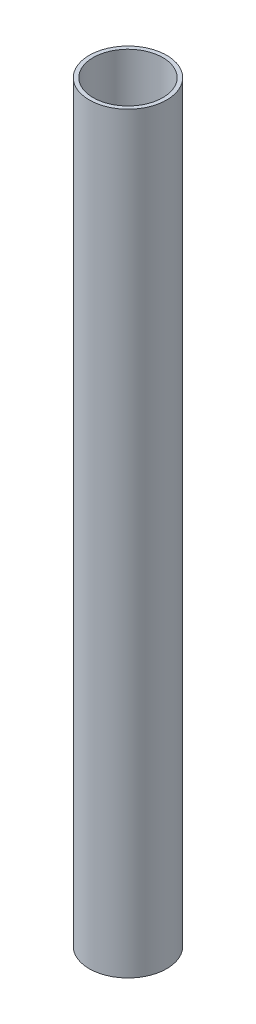
from build123d import *

# Parameters (mm, degrees)
SKETCH_1_R      = 12.35
SKETCH_1_R_2    = 11.1
EXTRUDE_1_DEPTH = 240


with BuildPart() as part:
    # Эскиз1 → Вытянуть1 (new body)
    with BuildSketch(Plane(origin=(0, 0, 0), x_dir=(1, 0, 0), z_dir=(0, 1, 0))):
        Circle(SKETCH_1_R)
        Circle(SKETCH_1_R_2, mode=Mode.SUBTRACT)
    extrude(amount=EXTRUDE_1_DEPTH)


solid = part.part
